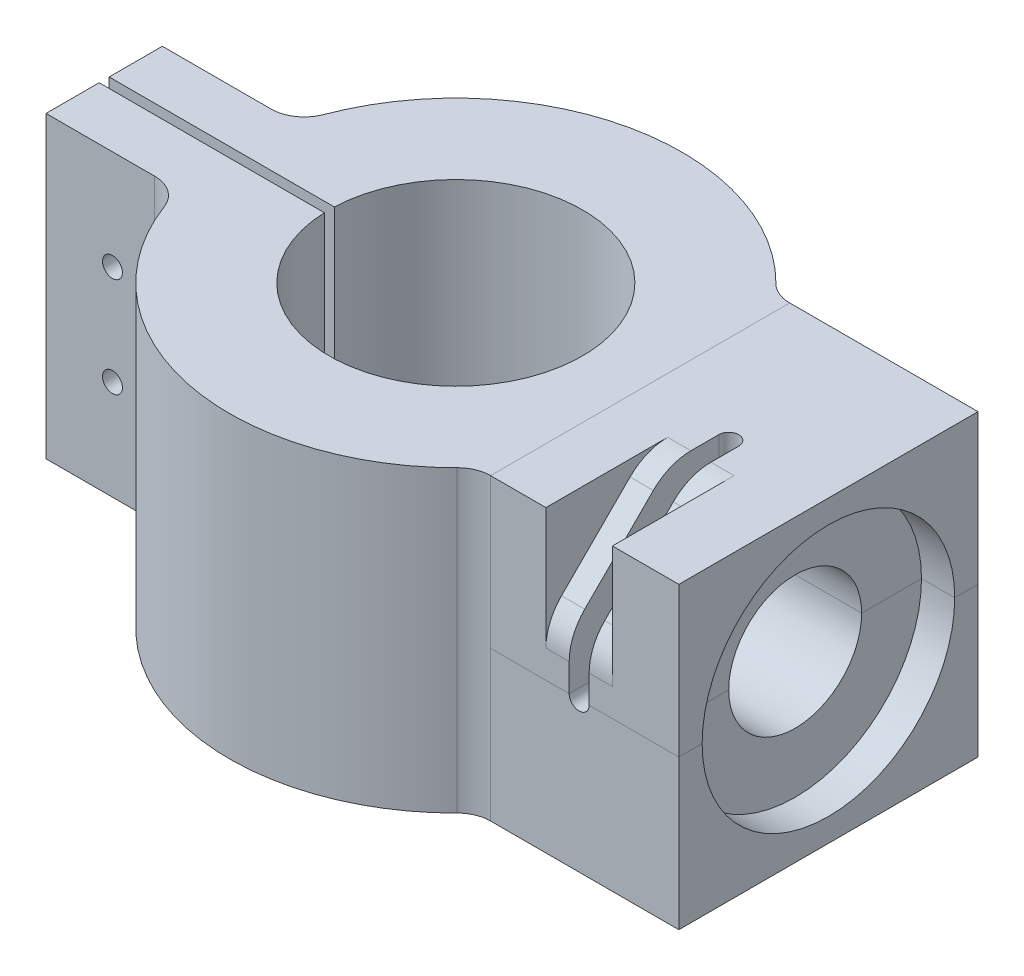
from build123d import *

# Parameters (mm, degrees)
BOSS_EXTRUDE1_DEPTH     = 22.5
F_3_0MM_DOWEL_HOLE1_D   = 3
BOSS_EXTRUDE2_START     = -8.493151603
BOSS_EXTRUDE2_OUTLINE_W = 45
BOSS_EXTRUDE2_OUTLINE_H = 45
BOSS_EXTRUDE2_DEPTH     = 30.493151603
SKETCH5_R               = 10
CUT_EXTRUDE1_DEPTH      = 35
SKETCH16_R              = 19
CUT_EXTRUDE9_DEPTH      = 5
CUT_EXTRUDE2_START      = 22.5
SKETCH7_W               = 7.1
SKETCH7_H               = 45
CUT_EXTRUDE2_DEPTH      = 40
SKETCH8_W               = 22.5
SKETCH8_H               = 22.5
CUT_EXTRUDE3_DEPTH      = 1.5
CUT_EXTRUDE5_OUTLINE_W  = 1.5
CUT_EXTRUDE5_OUTLINE_H  = 12.613186919
CUT_EXTRUDE8_START      = 9
CUT_EXTRUDE8_DEPTH      = 14
CHAMFER1_START          = 36.05
CHAMFER1_DEPTH          = 10
FILLET3_R               = 5
FILLET4_R               = 8
SKETCH23_W              = 45
SKETCH23_H              = 40
SKETCH23_R              = 16
BOSS_EXTRUDE5_DEPTH     = 7.1
SPLIT1_START            = 27.724582954
SPLIT1_DEPTH            = 23.325417046
SPLIT1_START_2          = 36.05
SPLIT1_2_DEPTH          = 15
SPLIT1_START_3          = 46.05
SPLIT1_3_DEPTH          = 10
SPLIT1_4_DEPTH          = 8.325417046
SPLIT1_5_DEPTH          = 1.225417046
SPLIT1_6_DEPTH          = 22.5
SPLIT1_7_DEPTH          = 22.5


with BuildPart() as part:
    # Sketch3 → Boss-Extrude1 (new, symmetric)
    with BuildSketch(Plane(origin=(0, 0, 0), x_dir=(1, 0, 0), z_dir=(0, 1, 0))):
        with BuildLine():
            Line((-52.906534306, 0.75), (-52.906534306, 8.75))
            Line((-52.906534306, 8.75), (-32.906534306, 8.75))
            ThreePointArc((-32.906534306, 8.75), (34.05, 0), (-32.906534306, -8.75))
            Line((-32.906534306, -8.75), (-52.906534306, -8.75))
            Line((-52.906534306, -8.75), (-52.906534306, -0.75))
            Line((-52.906534306, -0.75), (-19.035230495, -0.75))
            ThreePointArc((-19.035230495, -0.75), (19.05, 0), (-19.035230495, 0.75))
            Line((-19.035230495, 0.75), (-52.906534306, 0.75))
        make_face()
    extrude(amount=BOSS_EXTRUDE1_DEPTH, both=True)

    # Ø3.0mm Dowel Hole1 (through all)
    with Locations(Plane.XY.offset(8.75)):
        with Locations((-42.906534306, 7.5), (-42.906534306, -7.5)):
            Hole(F_3_0MM_DOWEL_HOLE1_D / 2)

    # Boss-Extrude2: read off the stored shape, not the designer's step
    # Boss-Extrude2 outline → Boss-Extrude2 (add)
    with BuildSketch(Plane(origin=(34.05, 0, 0), x_dir=(0, 0, -1), z_dir=(1, 0, 0)).offset(BOSS_EXTRUDE2_START)):
        Rectangle(BOSS_EXTRUDE2_OUTLINE_W, BOSS_EXTRUDE2_OUTLINE_H)
    extrude(amount=BOSS_EXTRUDE2_DEPTH)

    # Sketch5 → Cut-Extrude1 (cut)
    with BuildSketch(Plane(origin=(56.05, 0, 0), x_dir=(0, 0, -1), z_dir=(1, 0, 0))):
        Circle(SKETCH5_R)
    extrude(amount=-CUT_EXTRUDE1_DEPTH, mode=Mode.SUBTRACT)

    # Sketch16 → Cut-Extrude9 (cut)
    with BuildSketch(Plane(origin=(56.05, 0, 0), x_dir=(0, 0, -1), z_dir=(1, 0, 0))):
        Circle(SKETCH16_R)
    extrude(amount=-CUT_EXTRUDE9_DEPTH, mode=Mode.SUBTRACT)

    # Sketch7 → Cut-Extrude2 (cut)
    with BuildSketch(Plane(origin=(0, 0, 0), x_dir=(1, 0, 0), z_dir=(0, 1, 0)).offset(CUT_EXTRUDE2_START)):
        with Locations((32.5, 0)):
            Rectangle(SKETCH7_W, SKETCH7_H)
    extrude(amount=-CUT_EXTRUDE2_DEPTH, mode=Mode.SUBTRACT)

    # Sketch8 → Cut-Extrude3 (cut, symmetric)
    with BuildSketch(Plane.ZY.offset(-41.05)):
        with Locations((11.25, 11.25)):
            Rectangle(SKETCH8_W, SKETCH8_H)
    extrude(amount=CUT_EXTRUDE3_DEPTH, both=True, mode=Mode.SUBTRACT)

    # Cut-Extrude5: read off the stored shape, not the designer's step
    # Cut-Extrude5 outline → Cut-Extrude5 (revolve, cut)
    with BuildSketch(Plane(origin=(41.05, 0, 0), x_dir=(1, 0, 0), z_dir=(0, -1, 0))):
        with Locations((0.75, 16.19340654)):
            Rectangle(CUT_EXTRUDE5_OUTLINE_W, CUT_EXTRUDE5_OUTLINE_H)
    revolve(axis=Axis((41.05, 0, 0), (0, 0, 1)), mode=Mode.SUBTRACT)

    # Cut-Extrude8: read off the stored shape, not the designer's step
    # Cut-Extrude8 outline → Cut-Extrude8 (cut)
    with BuildSketch(Plane(origin=(0, 0, 0), x_dir=(1, 0, 0), z_dir=(0, 1, 0)).offset(CUT_EXTRUDE8_START)):
        with BuildLine():
            ThreePointArc((42.55, 0), (41.05, 1.5), (39.55, 0))
            Line((39.55, 0), (42.55, 0))
        make_face()
    extrude(amount=CUT_EXTRUDE8_DEPTH, mode=Mode.SUBTRACT)

    # Chamfer1: read off the stored shape, not the designer's step
    # Chamfer1 outline → Chamfer1 (cut)
    with BuildSketch(Plane.YZ.offset(CHAMFER1_START)):
        Polygon((22.5, 22.5), (7.5, 22.5), (22.5, 7.5), align=None)
    extrude(amount=CHAMFER1_DEPTH, mode=Mode.SUBTRACT)

    # Fillet3
    fillet3_edges = [part.edges().sort_by_distance(p)[0] for p in [
        (-32.906534306, 0, -8.75),
        (-32.906534306, 0, 8.75),
        (25.556848397, 0, -22.5),
        (25.556848397, 0, 22.5),
    ]]
    fillet(fillet3_edges, radius=FILLET3_R)

    # Fillet4
    fillet4_edges = [part.edges().sort_by_distance(p)[0] for p in [
        (37.8, 22.5, 7.5),
        (44.3, 22.5, 7.5),
        (37.8, 7.5, 22.5),
        (44.3, 7.5, 22.5),
    ]]
    fillet(fillet4_edges, radius=FILLET4_R)

    # Sketch23 → Boss-Extrude5 (add)
    with BuildSketch(Plane(origin=(28.95, 0, 0), x_dir=(0, 0, -1), z_dir=(1, 0, 0))):
        with Locations((0, 2.5)):
            Rectangle(SKETCH23_W, SKETCH23_H)
        with Locations(Location((0, 0, 0), (0, 0, 180))):
            Circle(SKETCH23_R, mode=Mode.SUBTRACT)
    extrude(amount=BOSS_EXTRUDE5_DEPTH)

    # Split1 7 outline → Split1 7 (cut)
    with BuildSketch(Plane(origin=(0, 0, 0), x_dir=(1, 0, 0), z_dir=(0, 1, 0))):
        with BuildLine():
            Line((27.724582954, 22.5), (27.724582954, -22.5))
            Line((27.724582954, -22.5), (39.55, -22.5))
            Line((39.55, -22.5), (39.55, 0))
            ThreePointArc((39.55, 0), (41.05, 1.5), (42.55, 0))
            Line((42.55, 0), (42.55, -22.5))
            Line((42.55, -22.5), (56.05, -22.5))
            Line((56.05, -22.5), (56.05, 22.5))
            Line((56.05, 22.5), (27.724582954, 22.5))
        make_face()
    extrude(amount=SPLIT1_7_DEPTH, mode=Mode.SUBTRACT)


with BuildPart() as body_2:
    # Split1: read off the stored shape, not the designer's step
    # Split1 outline → Split1 (new body)
    with BuildSketch(Plane.YZ.offset(SPLIT1_START)):
        with BuildLine():
            Line((4.186291501, 22.5), (0, 22.5))
            Line((0, 22.5), (0, 16))
            ThreePointArc((0, 16), (16, 0), (0, -16))
            Line((0, -16), (0, -22.5))
            Line((0, -22.5), (22.5, -22.5))
            Line((22.5, -22.5), (22.5, 4.186291501))
            ThreePointArc((22.5, 4.186291501), (21.89103626, 7.24775896), (20.156854249, 9.843145751))
            Line((20.156854249, 9.843145751), (9.843145751, 20.156854249))
            ThreePointArc((9.843145751, 20.156854249), (7.24775896, 21.89103626), (4.186291501, 22.5))
        make_face()
    extrude(amount=SPLIT1_DEPTH)

    # Split1 2 outline → Split1 2 (add)
    with BuildSketch(Plane.YZ.offset(SPLIT1_START_2)):
        with BuildLine():
            ThreePointArc((0, -16), (16, 0), (0, 16))
            Line((0, 16), (0, 10))
            ThreePointArc((0, 10), (10, 0), (0, -10))
            Line((0, -10), (0, -16))
        make_face()
    extrude(amount=SPLIT1_2_DEPTH)

    # Split1 3 outline → Split1 3 (add)
    with BuildSketch(Plane.YZ.offset(SPLIT1_START_3)):
        with BuildLine():
            Line((0, 22.5), (0, 19))
            ThreePointArc((0, 19), (19, 0), (0, -19))
            Line((0, -19), (0, -22.5))
            Line((0, -22.5), (22.5, -22.5))
            Line((22.5, -22.5), (22.5, 22.5))
            Line((22.5, 22.5), (0, 22.5))
        make_face()
    extrude(amount=SPLIT1_3_DEPTH)

    # Split1 4 outline → Split1 4 (add)
    with BuildSketch(Plane.YZ.offset(SPLIT1_START)):
        with BuildLine():
            Line((22.5, 22.5), (4.186291501, 22.5))
            ThreePointArc((4.186291501, 22.5), (7.24775896, 21.89103626), (9.843145751, 20.156854249))
            Line((9.843145751, 20.156854249), (20.156854249, 9.843145751))
            ThreePointArc((20.156854249, 9.843145751), (21.89103626, 7.24775896), (22.5, 4.186291501))
            Line((22.5, 4.186291501), (22.5, 22.5))
        make_face()
    extrude(amount=SPLIT1_4_DEPTH)

    # Split1 5 outline → Split1 5 (add)
    with BuildSketch(Plane.YZ.offset(SPLIT1_START)):
        with BuildLine():
            ThreePointArc((0, -16), (16, 0), (0, 16))
            Line((0, 16), (0, 10))
            ThreePointArc((0, 10), (10, 0), (0, -10))
            Line((0, -10), (0, -16))
        make_face()
    extrude(amount=SPLIT1_5_DEPTH)

    # Split1 6 outline → Split1 6 (cut)
    with BuildSketch(Plane(origin=(0, 0, 0), x_dir=(1, 0, 0), z_dir=(0, 1, 0))):
        with BuildLine():
            Line((39.55, 0), (39.55, -22.5))
            Line((39.55, -22.5), (42.55, -22.5))
            Line((42.55, -22.5), (42.55, 0))
            ThreePointArc((42.55, 0), (41.05, 1.5), (39.55, 0))
        make_face()
    extrude(amount=SPLIT1_6_DEPTH, mode=Mode.SUBTRACT)


solid = Compound([part.part, body_2.part])
